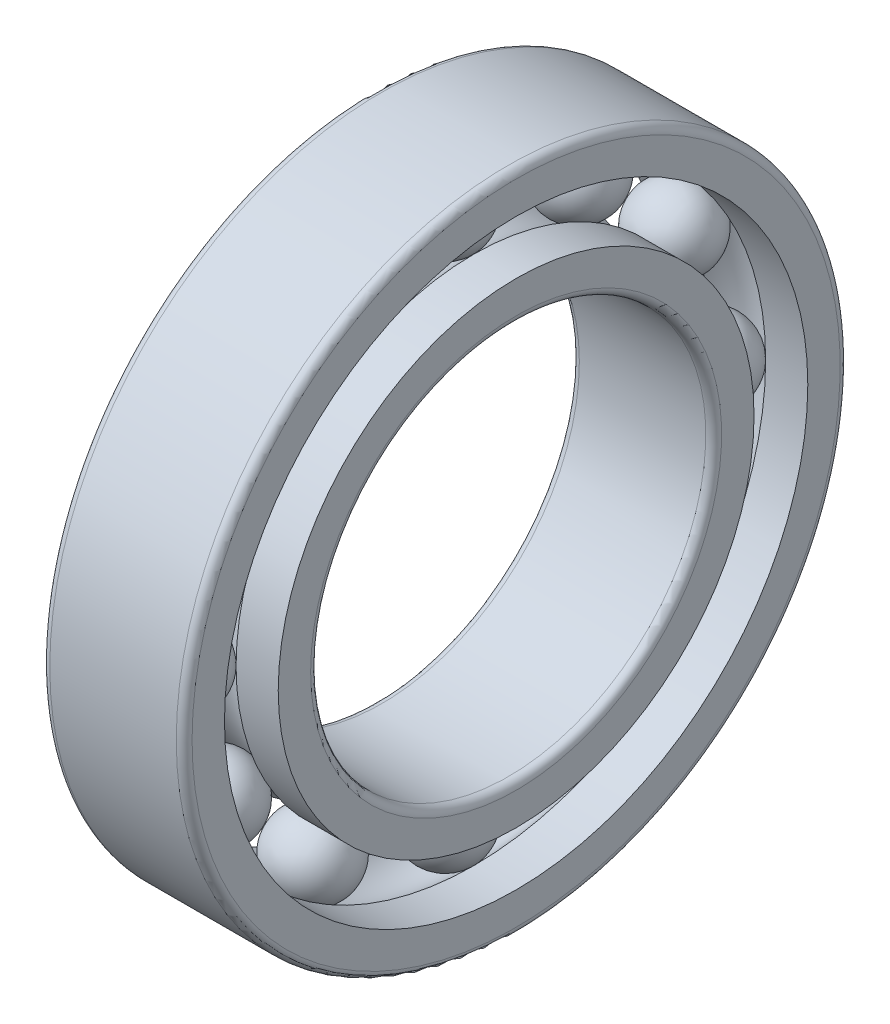
from build123d import *

# Parameters (mm, degrees)
FILLET_1_R               = 0.5
FILLET_2_R               = 0.5
PATTERN_CIRCULAR_1_COUNT = 12


with BuildPart() as part:
    # Эскиз1 → Повернуть1 (revolve)
    with BuildSketch(Plane.XY):
        with BuildLine():
            Line((0, 15.05), (0, 12.5))
            Line((0, 12.5), (9, 12.5))
            Line((9, 12.5), (9, 15.05))
            Line((9, 15.05), (6.333030278, 15.05))
            ThreePointArc((6.333030278, 15.05), (4.5, 14.25), (2.666969722, 15.05))
            Line((2.666969722, 15.05), (0, 15.05))
        make_face()
        with BuildLine():
            Line((9, 18.45), (9, 21))
            Line((9, 21), (0, 21))
            Line((0, 21), (0, 18.45))
            Line((0, 18.45), (2.666969722, 18.45))
            ThreePointArc((2.666969722, 18.45), (4.5, 19.25), (6.333030278, 18.45))
            Line((6.333030278, 18.45), (9, 18.45))
        make_face()
    revolve(axis=Axis((0, 0, 0), (1, 0, 0)))

    # Скругление1
    fillet_1_edges = [part.edges().sort_by_distance(p)[0] for p in [
        (9, -21, 0),
        (0, -21, 0),
    ]]
    fillet(fillet_1_edges, radius=FILLET_1_R)

    # Скругление2
    fillet_2_edges = [part.edges().sort_by_distance(p)[0] for p in [
        (9, -12.5, 0),
        (0, -12.5, 0),
    ]]
    fillet(fillet_2_edges, radius=FILLET_2_R)


with BuildPart() as body_2:
    # Эскиз2 → Повернуть4 (revolve)
    with BuildSketch(Plane.XY):
        with BuildLine():
            Line((2, 16.75), (7, 16.75))
            ThreePointArc((7, 16.75), (4.5, 19.25), (2, 16.75))
        make_face()
    revolve(axis=Axis((2, 16.75, 0), (1, 0, 0)))


with BuildPart() as pattern_circular_1_1:
    # Круговой массив1: pattern copy
    add(body_2.part.rotate(Axis((0, 0, 0), (-1, 0, 0)), 1 * 360 / PATTERN_CIRCULAR_1_COUNT))


with BuildPart() as pattern_circular_1_2:
    # Круговой массив1: pattern copy
    add(body_2.part.rotate(Axis((0, 0, 0), (-1, 0, 0)), 2 * 360 / PATTERN_CIRCULAR_1_COUNT))


with BuildPart() as pattern_circular_1_3:
    # Круговой массив1: pattern copy
    add(body_2.part.rotate(Axis((0, 0, 0), (-1, 0, 0)), 3 * 360 / PATTERN_CIRCULAR_1_COUNT))


with BuildPart() as pattern_circular_1_4:
    # Круговой массив1: pattern copy
    add(body_2.part.rotate(Axis((0, 0, 0), (-1, 0, 0)), 4 * 360 / PATTERN_CIRCULAR_1_COUNT))


with BuildPart() as pattern_circular_1_5:
    # Круговой массив1: pattern copy
    add(body_2.part.rotate(Axis((0, 0, 0), (-1, 0, 0)), 5 * 360 / PATTERN_CIRCULAR_1_COUNT))


with BuildPart() as pattern_circular_1_6:
    # Круговой массив1: pattern copy
    add(body_2.part.rotate(Axis((0, 0, 0), (-1, 0, 0)), 6 * 360 / PATTERN_CIRCULAR_1_COUNT))


with BuildPart() as pattern_circular_1_7:
    # Круговой массив1: pattern copy
    add(body_2.part.rotate(Axis((0, 0, 0), (-1, 0, 0)), 7 * 360 / PATTERN_CIRCULAR_1_COUNT))


with BuildPart() as pattern_circular_1_8:
    # Круговой массив1: pattern copy
    add(body_2.part.rotate(Axis((0, 0, 0), (-1, 0, 0)), 8 * 360 / PATTERN_CIRCULAR_1_COUNT))


with BuildPart() as pattern_circular_1_9:
    # Круговой массив1: pattern copy
    add(body_2.part.rotate(Axis((0, 0, 0), (-1, 0, 0)), 9 * 360 / PATTERN_CIRCULAR_1_COUNT))


with BuildPart() as pattern_circular_1_10:
    # Круговой массив1: pattern copy
    add(body_2.part.rotate(Axis((0, 0, 0), (-1, 0, 0)), 10 * 360 / PATTERN_CIRCULAR_1_COUNT))


with BuildPart() as pattern_circular_1_11:
    # Круговой массив1: pattern copy
    add(body_2.part.rotate(Axis((0, 0, 0), (-1, 0, 0)), 11 * 360 / PATTERN_CIRCULAR_1_COUNT))


solid = Compound([part.part, body_2.part, pattern_circular_1_1.part, pattern_circular_1_2.part, pattern_circular_1_3.part, pattern_circular_1_4.part, pattern_circular_1_5.part, pattern_circular_1_6.part, pattern_circular_1_7.part, pattern_circular_1_8.part, pattern_circular_1_9.part, pattern_circular_1_10.part, pattern_circular_1_11.part])
